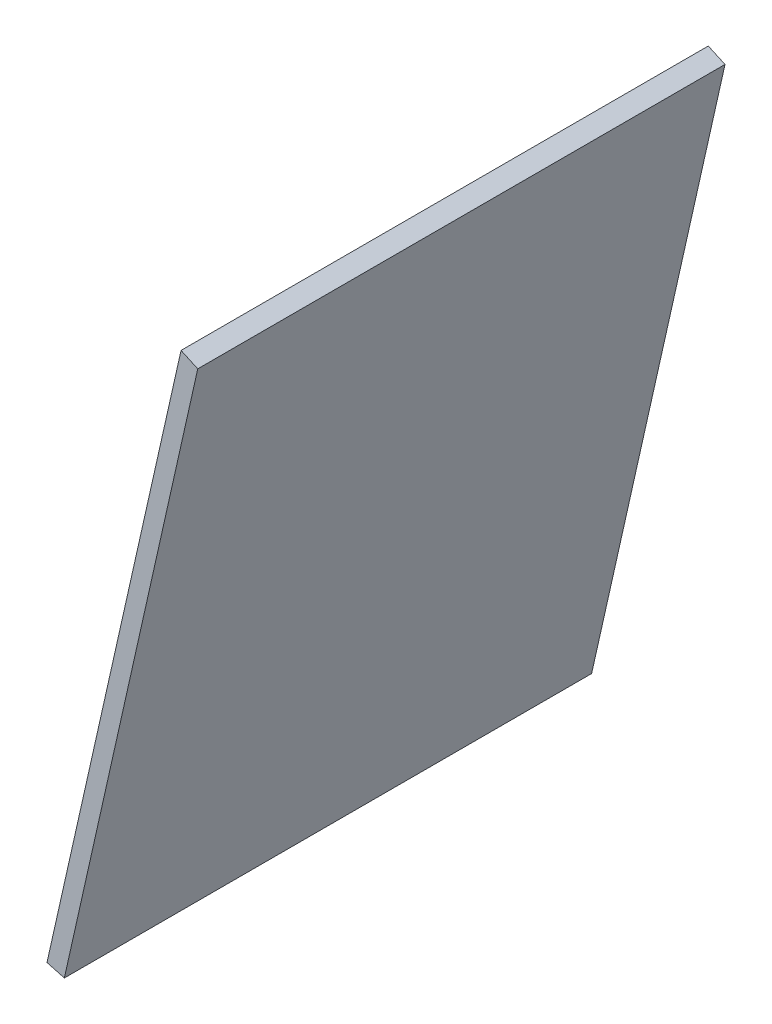
from build123d import *

# Parameters (mm, degrees)
BOSS_EXTRUDE1_DEPTH = 558.8


with BuildPart() as part:
    # Sketch1 → Boss-Extrude1 (new body)
    with BuildSketch(Plane.XY):
        Polygon((-596.865528173, 1608.234044775), (-738.251729964, 978.422782255), (-756.661390935, 983.387185214), (-614.581858176, 1616.286922049), align=None)
    extrude(amount=BOSS_EXTRUDE1_DEPTH)


solid = part.part
